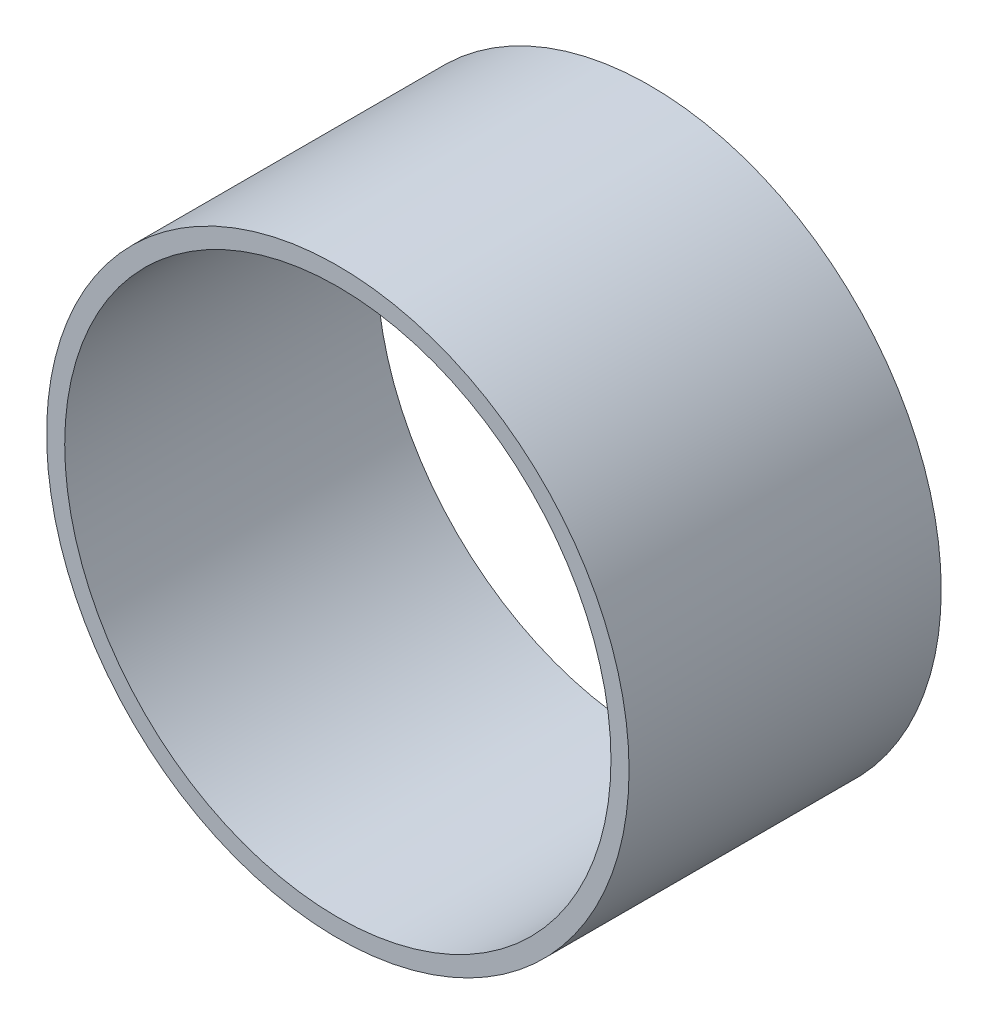
from build123d import *

# Parameters (mm, degrees)
SKETCH1_R           = 23.6982
SKETCH1_R_2         = 22.225
BOSS_EXTRUDE1_DEPTH = 25.4


with BuildPart() as part:
    # Sketch1 → Boss-Extrude1 (new body)
    with BuildSketch(Plane.XY):
        Circle(SKETCH1_R)
        Circle(SKETCH1_R_2, mode=Mode.SUBTRACT)
    extrude(amount=BOSS_EXTRUDE1_DEPTH)


solid = part.part
